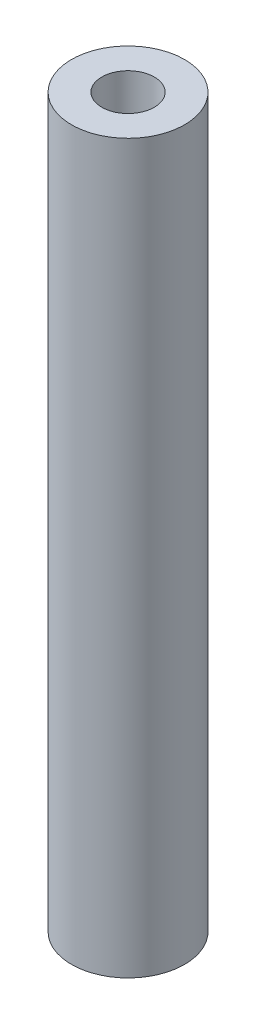
from build123d import *

# Parameters (mm, degrees)
SKETCH1_R           = 7
SKETCH1_R_2         = 3.25
BOSS_EXTRUDE1_DEPTH = 90


with BuildPart() as part:
    # Sketch1 → Boss-Extrude1 (new body)
    with BuildSketch(Plane(origin=(0, 0, 0), x_dir=(1, 0, 0), z_dir=(0, 1, 0))):
        Circle(SKETCH1_R)
        Circle(SKETCH1_R_2, mode=Mode.SUBTRACT)
    extrude(amount=BOSS_EXTRUDE1_DEPTH)


solid = part.part
